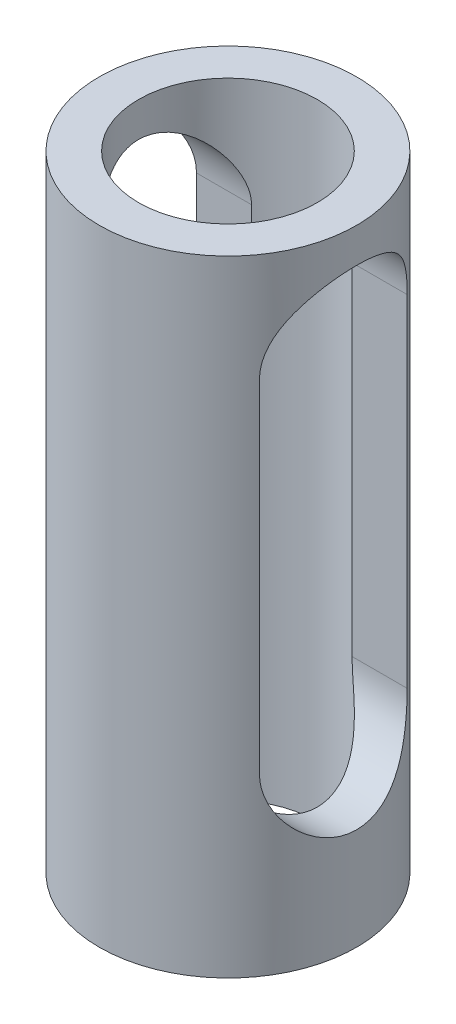
from build123d import *

# Parameters (mm, degrees)
SKETCH1_R           = 11.5
SKETCH1_R_2         = 7.9883
BOSS_EXTRUDE1_DEPTH = 55.88
CUT_EXTRUDE1_DEPTH  = 55.88


with BuildPart() as part:
    # Sketch1 → Boss-Extrude1 (new body)
    with BuildSketch(Plane(origin=(0, 0, 0), x_dir=(1, 0, 0), z_dir=(0, 1, 0))):
        Circle(SKETCH1_R)
        Circle(SKETCH1_R_2, mode=Mode.SUBTRACT)
    extrude(amount=BOSS_EXTRUDE1_DEPTH)

    # Sketch2 → Cut-Extrude1 (cut)
    with BuildSketch(Plane.ZY.offset(11.5)):
        with BuildLine():
            Line((6.604, 46.175816407), (6.604, 15.699520494))
            ThreePointArc((6.604, 15.699520494), (0, 9.095520494), (-6.604, 15.699520494))
            Line((-6.604, 15.699520494), (-6.604, 46.175816407))
            ThreePointArc((-6.604, 46.175816407), (0, 52.779816407), (6.604, 46.175816407))
        make_face()
    extrude(amount=-CUT_EXTRUDE1_DEPTH, mode=Mode.SUBTRACT)


solid = part.part
